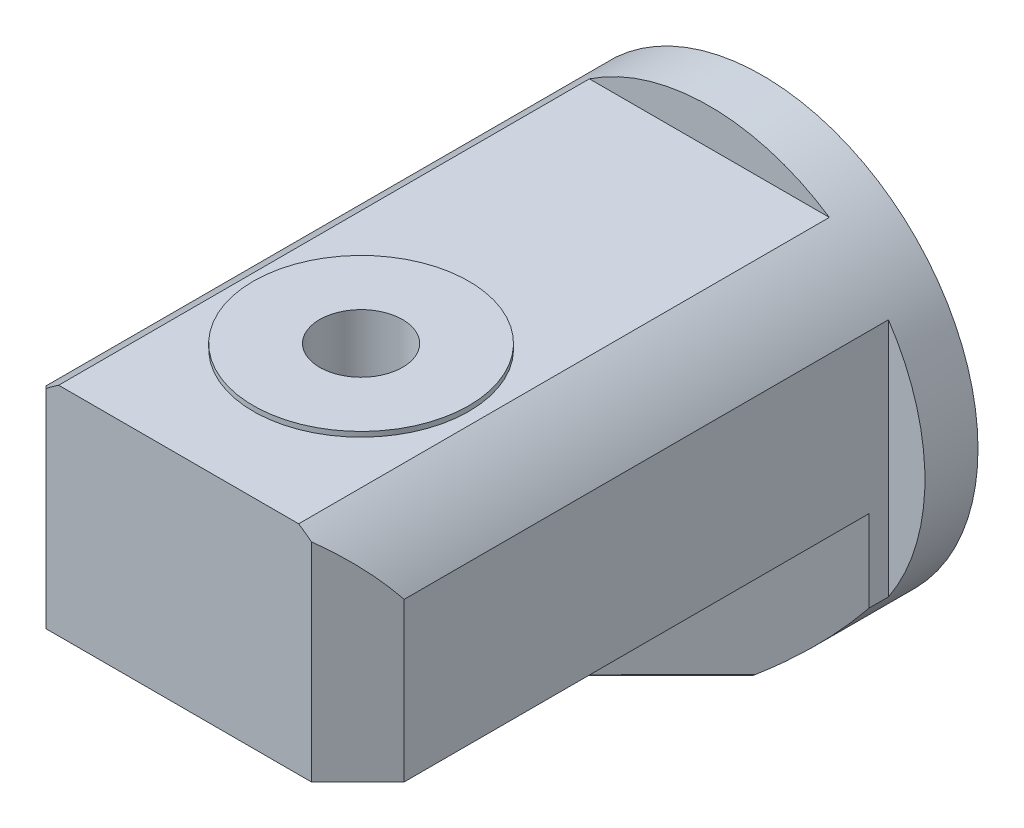
from build123d import *

# Parameters (mm, degrees)
SKETCH3_R             = 130
BOSS_EXTRUDE1_DEPTH   = 352
CUT_EXTRUDE2_START    = -320
CUT_EXTRUDE2_DEPTH    = 320
CUT_EXTRUDE3_START    = -320
CUT_EXTRUDE3_DEPTH    = 320
CUT_EXTRUDE4_DEPTH    = 85
CUT_EXTRUDE5_DEPTH    = 85
CUT_EXTRUDE7_REACH    = 420.413
CUT_EXTRUDE8_REACH    = 420.413
CUT_EXTRUDE9_DEPTH    = 285
BOSS_EXTRUDE2_DEPTH   = 3
SKETCH22_W            = 60
SKETCH22_H            = 60
BOSS_EXTRUDE3_DEPTH   = 2
FILLET1_R             = 3
FILLET2_R             = 3
FILLET4_R             = 1
FILLET5_R             = 1
BODY_MOVE_COPY2_ANGLE = 90
BODY_MOVE_COPY3_ANGLE = 90
BODY_MOVE_COPY4_ANGLE = 180
SKETCH37_R            = 25
CUT_EXTRUDE20_DEPTH   = 50


with BuildPart() as part:
    # Sketch3 → Boss-Extrude1 (new body)
    with BuildSketch(Plane(origin=(0, 0, 0), x_dir=(1, 0, 0), z_dir=(0, 1, 0))):
        Circle(SKETCH3_R)
    extrude(amount=BOSS_EXTRUDE1_DEPTH)

    # Sketch11 → Cut-Extrude2 (cut)
    with BuildSketch(Plane(origin=(0, 352, 0), x_dir=(1, 0, 0), z_dir=(0, 1, 0)).offset(CUT_EXTRUDE2_START)):
        with BuildLine():
            Line((72.360210061, -108), (-72.360210061, -108))
            ThreePointArc((-72.360210061, -108), (0, -130), (72.360210061, -108))
        make_face()
        with BuildLine():
            Line((-72.360210061, 108), (72.360210061, 108))
            ThreePointArc((72.360210061, 108), (0, 130), (-72.360210061, 108))
        make_face()
    extrude(amount=CUT_EXTRUDE2_DEPTH, mode=Mode.SUBTRACT)

    # Sketch11<4> → Cut-Extrude3 (cut)
    with BuildSketch(Plane(origin=(0, 352, 0), x_dir=(1, 0, 0), z_dir=(0, 1, 0)).offset(CUT_EXTRUDE3_START)):
        with BuildLine():
            Line((108, 72.360210061), (108, -72.360210061))
            ThreePointArc((108, -72.360210061), (130, 0), (108, 72.360210061))
        make_face()
        with BuildLine():
            ThreePointArc((-108, 72.360210061), (-130, 0), (-108, -72.360210061))
            Line((-108, -72.360210061), (-108, 72.360210061))
        make_face()
    extrude(amount=CUT_EXTRUDE3_DEPTH, mode=Mode.SUBTRACT)

    # Sketch12 → Cut-Extrude4 (cut)
    with BuildSketch(Plane.ZY.offset(108)):
        Polygon((-72.360210061, 137), (0, 137), (72.360210061, 137), (72.360210061, 352), (-72.360210061, 352), align=None)
    extrude(amount=-CUT_EXTRUDE4_DEPTH, mode=Mode.SUBTRACT)

    # Sketch14 → Cut-Extrude5 (cut)
    with BuildSketch(Plane.ZY.offset(108)):
        Polygon((-72.360210061, 79.254886678), (-14.615096739, 137), (-72.360210061, 137), align=None)
        Polygon((72.360210061, 137), (14.615096739, 137), (72.360210061, 79.254886678), align=None)
    extrude(amount=-CUT_EXTRUDE5_DEPTH, mode=Mode.SUBTRACT)

    # Cut-Extrude7: up to this plane
    cut_extrude7_end = Plane(origin=(-23, 75.807548369, -75.807548369), z_dir=(0, 0.7071067811865563, -0.7071067811865388))
    # Sketch15 → Cut-Extrude7 (cut, up to the surface)
    with BuildSketch(Plane(origin=(0, 352, 0), x_dir=(1, 0, 0), z_dir=(0, 1, 0)), mode=Mode.PRIVATE) as cut_extrude7_sk1:
        with BuildLine():
            Line((-108, 72.360210061), (-23, 72.360210061))
            Line((-23, 72.360210061), (-23, 108))
            Line((-23, 108), (-72.360210061, 108))
            ThreePointArc((-72.360210061, 108), (-91.923881554, 91.923881554), (-108, 72.360210061))
        make_face()
    cut_extrude7_tool1 = split(extrude(cut_extrude7_sk1.sketch, amount=-CUT_EXTRUDE7_REACH, mode=Mode.PRIVATE), bisect_by=cut_extrude7_end, keep=Keep.BOTH, mode=Mode.PRIVATE)
    add(cut_extrude7_tool1.solids().sort_by_distance((-58.500557, 352, -88.680695))[0], mode=Mode.SUBTRACT)

    # Cut-Extrude8: up to this plane
    cut_extrude8_end = Plane(origin=(-23, 75.807548369, 75.807548369), z_dir=(0, -0.7071067811865561, -0.707106781186539))
    # Sketch15<4> → Cut-Extrude8 (cut, up to the surface)
    with BuildSketch(Plane(origin=(0, 352, 0), x_dir=(1, 0, 0), z_dir=(0, 1, 0)), mode=Mode.PRIVATE) as cut_extrude8_sk1:
        with BuildLine():
            Line((-23, -108), (-23, -72.360210061))
            Line((-23, -72.360210061), (-108, -72.360210061))
            ThreePointArc((-108, -72.360210061), (-91.923881554, -91.923881554), (-72.360210061, -108))
            Line((-72.360210061, -108), (-23, -108))
        make_face()
    cut_extrude8_tool1 = split(extrude(cut_extrude8_sk1.sketch, amount=-CUT_EXTRUDE8_REACH, mode=Mode.PRIVATE), bisect_by=cut_extrude8_end, keep=Keep.BOTH, mode=Mode.PRIVATE)
    add(cut_extrude8_tool1.solids().sort_by_distance((-58.500557, 352, 88.680695))[0], mode=Mode.SUBTRACT)

    # Sketch18 → Cut-Extrude9 (cut)
    with BuildSketch(Plane.ZY.offset(23)):
        Polygon((-108, 324), (-80, 352), (-108, 352), align=None)
        Polygon((108, 352), (80, 352), (108, 324), align=None)
    extrude(amount=-CUT_EXTRUDE9_DEPTH, mode=Mode.SUBTRACT)

    # Sketch19 → Boss-Extrude2 (add)
    with BuildSketch(Plane(origin=(108, 0, 0), x_dir=(0, 0, -1), z_dir=(1, 0, 0))):
        with BuildLine():
            ThreePointArc((0, 307), (-45.961940777, 196.038059223), (65, 242))
            ThreePointArc((65, 242), (45.961940777, 287.961940777), (0, 307))
        make_face()
    extrude(amount=BOSS_EXTRUDE2_DEPTH)

    # Sketch22 → Boss-Extrude3 (add)
    with BuildSketch(Plane.ZY.offset(108)):
        with Locations((-13.4876534, 78.127443339)):
            Rectangle(SKETCH22_W, SKETCH22_H)
    extrude(amount=BOSS_EXTRUDE3_DEPTH)

    # Fillet1
    fillet1_edges = [part.edges().sort_by_distance(p)[0] for p in [
        (-109, 108.127443339, -43.4876534),
    ]]
    fillet(fillet1_edges, radius=FILLET1_R)

    # Fillet2
    fillet2_edges = [part.edges().sort_by_distance(p)[0] for p in [
        (-109, 48.127443339, -43.4876534),
        (-109, 48.127443339, 16.5123466),
        (-109, 108.127443339, 16.5123466),
    ]]
    fillet(fillet2_edges, radius=FILLET2_R)

    # Fillet4
    fillet4_edges = [part.edges().sort_by_distance(p)[0] for p in [
        (-108, 108.127443339, -43.4876534),
        (-108, 108.127443339, -43.4876534),
        (-108, 108.127443339, 43.4876534),
    ]]
    fillet(fillet4_edges, radius=FILLET4_R)

    # Fillet5
    fillet5_edges = [part.edges().sort_by_distance(p)[0] for p in [
        (-108, 107.248763683, -42.608973743),
        (-108, 78.127443339, -43.4876534),
        (-108, 49.006122995, -42.608973743),
        (-108, 48.127443339, -13.4876534),
        (-108, 49.006122995, 15.633666944),
        (-108, 78.127443339, 16.5123466),
        (-108, 107.248763683, 15.633666944),
        (-108, 108.127443339, -13.4876534),
    ]]
    fillet(fillet5_edges, radius=FILLET5_R)


with BuildPart() as part_1:
    # Body-Move/Copy2: moved
    add(part.part.rotate(Axis((0, 0, 0), (1, 0, 0)), BODY_MOVE_COPY2_ANGLE))


with BuildPart() as part_2:
    # Body-Move/Copy3: moved
    add(part_1.part.rotate(Axis((0, 0, 0), (0, 0, -1)), BODY_MOVE_COPY3_ANGLE))


with BuildPart() as part_3:
    # Body-Move/Copy4: moved
    add(part_2.part.rotate(Axis((0, 0, 0), (0, 0, 1)), BODY_MOVE_COPY4_ANGLE))

    # Sketch37 → Cut-Extrude20 (cut)
    with BuildSketch(Plane(origin=(0, 111, 0), x_dir=(1, 0, 0), z_dir=(0, 1, 0))):
        with Locations((0, -242)):
            Circle(SKETCH37_R)
    extrude(amount=-CUT_EXTRUDE20_DEPTH, mode=Mode.SUBTRACT)


solid = part_3.part
